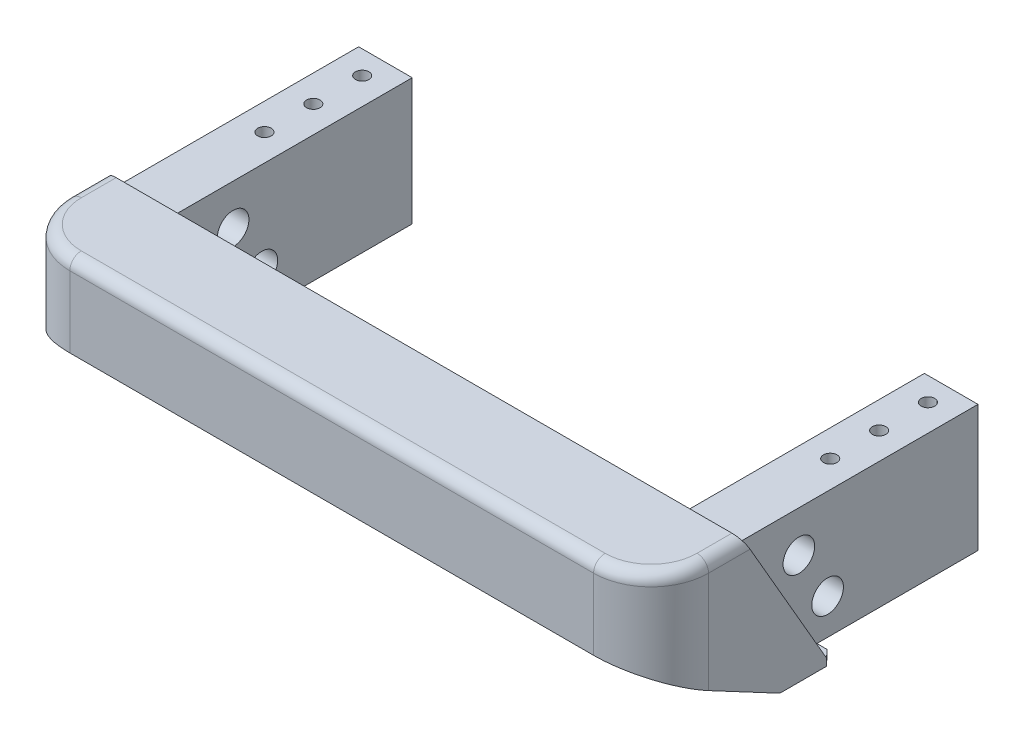
from build123d import *

# Parameters (mm, degrees)
BOSS_EXTRUDE1_DEPTH = 222.25
BOSS_EXTRUDE3_DEPTH = 85
SKETCH15_R          = 2.349500000000014
CUT_EXTRUDE6_DEPTH  = 15
SKETCH16_R          = 5.499999999999996
SKETCH16_R_2        = 5.499999999999989
CUT_EXTRUDE7_DEPTH  = 224.37343312265227
BOSS_EXTRUDE5_DEPTH = 222.25
CUT_EXTRUDE3_DEPTH  = 222.25
BOSS_EXTRUDE6_DEPTH = 222.25
CUT_EXTRUDE4_REACH  = 245.691
SKETCH10_W          = 86.747166
SKETCH10_H          = 3.084529946162071
CHAMFER1_SIZE       = 3.5
CUT_EXTRUDE5_REACH  = 245.691
FILLET1_R           = 4
FILLET2_R           = 20
FILLET3_R           = 4


with BuildPart() as part:
    # Sketch1 → Boss-Extrude1 (new body)
    with BuildSketch(Plane(origin=(0, 0, 0), x_dir=(0, 0, -1), z_dir=(1, 0, 0))):
        Polygon((0, 0), (0, 50.8), (29.32939367483333, 0), align=None)
    extrude(amount=BOSS_EXTRUDE1_DEPTH)

    # Sketch3 → Boss-Extrude3 (add)
    with BuildSketch(Plane.XY):
        Polygon((218.875, 47.425), (200.22500000000002, 47.425), (200.22500000000002, 3.374999999999998), (218.875, 3.375), align=None)
    boss_extrude3 = extrude(amount=-BOSS_EXTRUDE3_DEPTH)

    # Sketch15 → Cut-Extrude6 (cut)
    with BuildSketch(Plane(origin=(0, 47.425, 0), x_dir=(1, 0, 0), z_dir=(0, 1, 0))):
        with Locations(Location((209.55000000000064, 59.90863352220276, 0), (0, 0, 270))):
            Circle(SKETCH15_R)
        with Locations(Location((209.55000000000064, 42.90863352220276, 0), (0, 0, 270))):
            Circle(SKETCH15_R)
        with Locations(Location((209.55000000000064, 76.90863352220276, 0), (0, 0, 270))):
            Circle(SKETCH15_R)
    cut_extrude6 = extrude(amount=-CUT_EXTRUDE6_DEPTH, mode=Mode.SUBTRACT)

    # Sketch16 → Cut-Extrude7 (cut, through all)
    with BuildSketch(Plane.ZY.offset(-200.22500000000002)):
        with Locations((-22.67268904895815, 33.11725062299641)):
            Circle(SKETCH16_R)
        with Locations((-32.67268904895816, 15.796742547307629)):
            Circle(SKETCH16_R_2)
    cut_extrude7 = extrude(amount=-CUT_EXTRUDE7_DEPTH, mode=Mode.SUBTRACT)

    # Mirror1: Boss-Extrude3, Cut-Extrude6, Cut-Extrude7 across plane
    add(boss_extrude3.mirror(Plane.ZY.offset(-111.125)))
    add(cut_extrude6.mirror(Plane.ZY.offset(-111.125)), mode=Mode.SUBTRACT)
    add(cut_extrude7.mirror(Plane.ZY.offset(-111.125)), mode=Mode.SUBTRACT)

    # Sketch7 → Boss-Extrude5 (add)
    with BuildSketch(Plane(origin=(222.25, 0, 0), x_dir=(0, 0, -1), z_dir=(1, 0, 0))):
        Polygon((0, 50.8), (-32.128627, 50.79999999999999), (-32.128626999999994, 22.043620610825506), (9.32939367483333, 0), (29.32939367483333, 0), align=None)
    extrude(amount=-BOSS_EXTRUDE5_DEPTH)

    # Sketch8 → Cut-Extrude3 (cut)
    with BuildSketch(Plane(origin=(222.25, 0, 0), x_dir=(0, 0, -1), z_dir=(1, 0, 0))):
        Polygon((0, 4.960526608591835), (9.32939367483333, 0), (0, 0), align=None)
    extrude(amount=-CUT_EXTRUDE3_DEPTH, mode=Mode.SUBTRACT)

    # Sketch9 → Boss-Extrude6 (add)
    with BuildSketch(Plane(origin=(222.25, 0, 0), x_dir=(0, 0, -1), z_dir=(1, 0, 0))):
        Polygon((32.52939367483333, -1.7875), (12.691192231639896, -1.7875000000000023), (9.32939367483333, 0), (29.32939367483333, 0), (29.44486372867126, -0.2000000000000005), (32.52939367483333, -0.2), align=None)
    extrude(amount=-BOSS_EXTRUDE6_DEPTH)

    # Sketch10 → Cut-Extrude4 (cut, up to next)
    with BuildSketch(Plane.XZ.offset(1.7875000000000039), mode=Mode.PRIVATE) as cut_extrude4_sk1:
        Polygon((218.872166, -32.52939367483333), (222.25, -28.82939367483333), (222.25, -32.52939367483333), align=None)
    cut_extrude4_tool1 = extrude(cut_extrude4_sk1.sketch, amount=-CUT_EXTRUDE4_REACH, mode=Mode.PRIVATE) & part.part
    # Sketch10 → Cut-Extrude4 (cut, up to next)
    with BuildSketch(Plane.XZ.offset(1.7875000000000039), mode=Mode.PRIVATE) as cut_extrude4_sk2:
        with Locations((154.49858300000002, -30.987128701752294)):
            Rectangle(SKETCH10_W, SKETCH10_H)
    cut_extrude4_tool2 = extrude(cut_extrude4_sk2.sketch, amount=-CUT_EXTRUDE4_REACH, mode=Mode.PRIVATE) & part.part
    cut_extrude4_1 = cut_extrude4_tool1.solids().sort_by_distance((221.124055, -1.7875, -31.29606))[0]
    add(cut_extrude4_1, mode=Mode.SUBTRACT)
    cut_extrude4_2 = cut_extrude4_tool2.solids().sort_by_distance((154.498583, -1.7875, -30.987129))[0]
    add(cut_extrude4_2, mode=Mode.SUBTRACT)
    cut_extrude4 = cut_extrude4_1 + cut_extrude4_2  # Cut-Extrude4 as one shape, for the pattern or mirror that repeats it

    # Mirror2: Cut-Extrude4 across plane
    add(cut_extrude4.mirror(Plane.ZY.offset(-111.125)), mode=Mode.SUBTRACT)

    # Chamfer1
    # the kernel refuses this chamfer: 3.5 mm, written as the material it takes off along each edge
    with BuildSketch(Plane(origin=(24.37783399999998, -10.788390457880682, -32.52939367483333), x_dir=(-0.9996219169112968, 0, -0.027495876610586126), z_dir=(0, 1, 1.7e-16))) as chamfer1_piece_1_section:
        Polygon((CHAMFER1_SIZE * 0.999621916911, CHAMFER1_SIZE * 0.0274958766106), (-CHAMFER1_SIZE * 0.0274958766106, CHAMFER1_SIZE * 0.999621916911), (0, 0), align=None)
    chamfer1_piece_1 = extrude(amount=10.588390457880683, mode=Mode.PRIVATE)
    chamfer1_piece_1 = split(chamfer1_piece_1, bisect_by=Plane(origin=(23.984976555626393, -1.314391432651377, -29.444863728671262), z_dir=(0, 1.7e-16, -1)), keep=Keep.TOP, mode=Mode.PRIVATE)
    add(chamfer1_piece_1, mode=Mode.SUBTRACT)
    with BuildSketch(Plane(origin=(197.87216600000002, -10.788390457880718, -32.52939367483333), x_dir=(-0.02749587661059007, 0, 0.9996219169112966), z_dir=(0, 1, 1.7e-16))) as chamfer1_piece_2_section:
        Polygon((CHAMFER1_SIZE * 0.999621916911, CHAMFER1_SIZE * 0.0274958766106), (-CHAMFER1_SIZE * 0.0274958766106, CHAMFER1_SIZE * 0.999621916911), (0, 0), align=None)
    chamfer1_piece_2 = extrude(amount=10.588390457880719, mode=Mode.PRIVATE)
    chamfer1_piece_2 = split(chamfer1_piece_2, bisect_by=Plane(origin=(198.26502344437364, -1.3143914326513721, -29.444863728671262), z_dir=(0, 1.7e-16, -1)), keep=Keep.TOP, mode=Mode.PRIVATE)
    add(chamfer1_piece_2, mode=Mode.SUBTRACT)

    # Cut-Extrude5: up to this plane
    cut_extrude5_end = Plane(origin=(222.25, 50.8, 0), z_dir=(0, -0.5000000000000044, 0.8660254037844362))
    # Sketch11 → Cut-Extrude5 (cut, up to the surface)
    with BuildSketch(Plane.XZ.offset(1.7875000000000039), mode=Mode.PRIVATE) as cut_extrude5_sk1:
        Polygon((66.12499999999999, -29.444863728671255), (156.125, -29.444863728671255), (156.125, -12.691192231639896), (66.12500000000001, -12.691192231639896), align=None)
    cut_extrude5_tool1 = split(extrude(cut_extrude5_sk1.sketch, amount=-CUT_EXTRUDE5_REACH, mode=Mode.PRIVATE), bisect_by=cut_extrude5_end, keep=Keep.BOTH, mode=Mode.PRIVATE)
    add(cut_extrude5_tool1.solids().sort_by_distance((111.125, -1.7875, -21.068028))[0], mode=Mode.SUBTRACT)

    # Fillet1
    fillet1_edges = [part.edges().sort_by_distance(p)[0] for p in [
        (111.125, -1.7875000000000016, -12.691192231639896),
    ]]
    fillet(fillet1_edges, radius=FILLET1_R)

    # Fillet2
    fillet2_edges = [part.edges().sort_by_distance(p)[0] for p in [
        (222.25, 36.42181030541275, 32.128627),
        (0, 36.42181030541275, 32.128627),
    ]]
    fillet(fillet2_edges, radius=FILLET2_R)

    # Fillet3
    fillet3_edges = [part.edges().sort_by_distance(p)[0] for p in [
        (222.25, 50.8, 6.064313500000003),
        (0, 50.8, 6.0643135000000035),
        (111.125, 50.79999999999999, 32.128627),
        (216.39213562373095, 50.8, 26.270762623730953),
        (5.857864376269047, 50.8, 26.27076262373096),
    ]]
    fillet(fillet3_edges, radius=FILLET3_R)


solid = part.part
